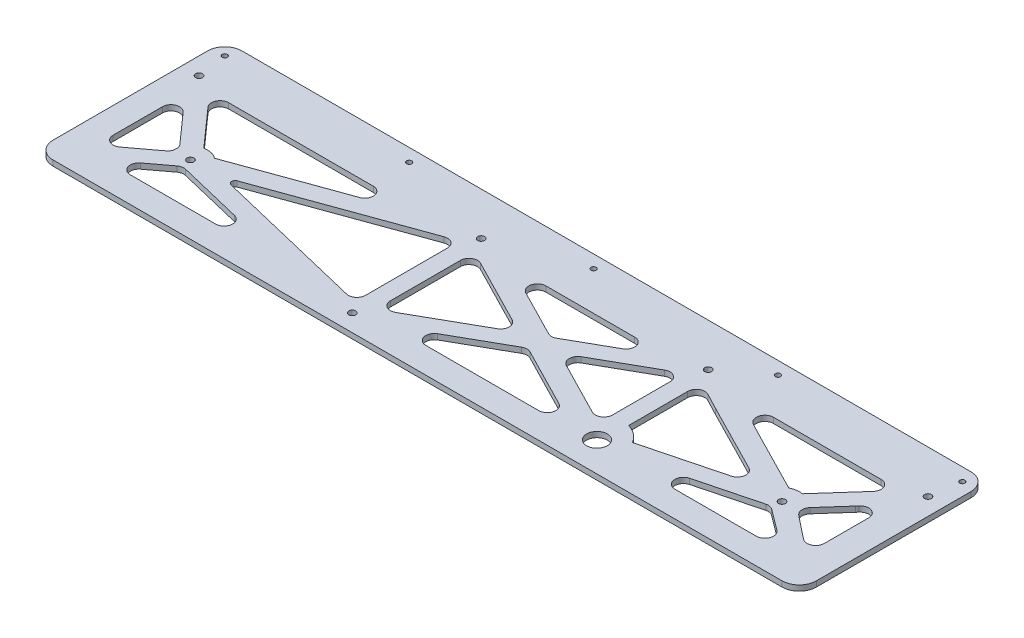
from build123d import *

# Parameters (mm, degrees)
SKETCH1_R           = 2
SKETCH1_R_2         = 6
SKETCH1_R_3         = 1.5
BOSS_EXTRUDE1_DEPTH = 3.175
FILLET1_R           = 10
CUT_EXTRUDE1_DEPTH  = 10


with BuildPart() as part:
    # Sketch1 → Boss-Extrude1 (new body)
    with BuildSketch(Plane(origin=(0, 0, 0), x_dir=(1, 0, 0), z_dir=(0, 1, 0))):
        Polygon((-26.799577535, 0), (417.700422465, 0), (417.700422465, 17.22815868), (417.700422465, 110), (-26.799577535, 110), align=None)
        with Locations((23.200422465, 40)):
            Circle(SKETCH1_R, mode=Mode.SUBTRACT)
        with Locations((367.700422465, 40)):
            Circle(SKETCH1_R, mode=Mode.SUBTRACT)
        with Locations((147.450422465, 10)):
            Circle(SKETCH1_R, mode=Mode.SUBTRACT)
        with Locations((282.700422465, 17.22815868)):
            Circle(SKETCH1_R_2, mode=Mode.SUBTRACT)
        with Locations((-16.799577535, 85)):
            Circle(SKETCH1_R, mode=Mode.SUBTRACT)
        with Locations((147.450422465, 85)):
            Circle(SKETCH1_R, mode=Mode.SUBTRACT)
        with Locations((279.700422465, 85)):
            Circle(SKETCH1_R, mode=Mode.SUBTRACT)
        with Locations((407.700422465, 85)):
            Circle(SKETCH1_R, mode=Mode.SUBTRACT)
        with Locations((-19.299577535, 102.5)):
            Circle(SKETCH1_R_3, mode=Mode.SUBTRACT)
        with Locations((88.075422465, 102.5)):
            Circle(SKETCH1_R_3, mode=Mode.SUBTRACT)
        with Locations((195.450422465, 102.5)):
            Circle(SKETCH1_R_3, mode=Mode.SUBTRACT)
        with Locations((302.825422465, 102.5)):
            Circle(SKETCH1_R_3, mode=Mode.SUBTRACT)
        with Locations((410.200422465, 102.5)):
            Circle(SKETCH1_R_3, mode=Mode.SUBTRACT)
    extrude(amount=BOSS_EXTRUDE1_DEPTH)

    # Fillet1
    fillet1_edges = [part.edges().sort_by_distance(p)[0] for p in [
        (417.700422465, 1.5875, -110),
        (417.700422465, 1.5875, 0),
        (-26.799577535, 1.5875, 0),
        (-26.799577535, 1.5875, -110),
    ]]
    fillet(fillet1_edges, radius=FILLET1_R)

    # Sketch2 → Cut-Extrude1 (cut)
    with BuildSketch(Plane(origin=(0, 3.175, 0), x_dir=(1, 0, 0), z_dir=(0, 1, 0))):
        with BuildLine():
            Line((63.988295206, 24.860334116), (26.456586442, 33.922316112))
            ThreePointArc((26.456586442, 33.922316112), (24.273585164, 33.959016834), (22.283065126, 33.061981996))
            Line((22.283065126, 33.061981996), (10.200422465, 24))
            ThreePointArc((10.200422465, 24), (8.457005975, 18.41886117), (13.200422465, 15))
            Line((13.200422465, 15), (62.81477389, 15))
            ThreePointArc((62.81477389, 15), (67.779734645, 19.409098393), (63.988295206, 24.860334116))
        make_face()
        with BuildLine():
            Line((1.731814293, 71.678180806), (21.183909441, 49.794573764))
            ThreePointArc((21.183909441, 49.794573764), (25.478109933, 49.737152551), (29.35222616, 47.883863983))
            Line((29.35222616, 47.883863983), (83.514557274, 67.5))
            Line((83.514557274, 67.5), (91.361350439, 70.2886824))
            ThreePointArc((91.361350439, 70.2886824), (94.61428981, 75.849532813), (89.686988926, 80))
            Line((89.686988926, 80), (5.468860886, 80))
            ThreePointArc((5.468860886, 80), (0.907660607, 77.048280258), (1.731814293, 71.678180806))
        make_face()
        with BuildLine():
            ThreePointArc((13.203172612, 39.765489068), (13.250707237, 41.001582191), (13.450490987, 42.222349247))
            ThreePointArc((13.450490987, 42.222349247), (13.034220935, 43.599450655), (12.243072673, 44.801021905))
            Line((12.243072673, 44.801021905), (-3.062530941, 62.019825971))
            ThreePointArc((-3.062530941, 62.019825971), (-8.576480322, 63.371615284), (-11.799577535, 58.698006777))
            Line((-11.799577535, 58.698006777), (-11.799577535, 30))
            ThreePointArc((-11.799577535, 30), (-9.035645512, 25.527864045), (-3.799577535, 26))
            Line((-3.799577535, 26), (11.506026079, 37.479202711))
            ThreePointArc((11.506026079, 37.479202711), (12.520785414, 38.498983342), (13.203172612, 39.765489068))
        make_face()
        with BuildLine():
            Line((47.554716749, 39.2633668), (136.276901149, 17.841511412))
            ThreePointArc((136.276901149, 17.841511412), (140.543349349, 18.773257577), (142.450422465, 22.701845528))
            Line((142.450422465, 22.701845528), (142.450422465, 70.404600889))
            ThreePointArc((142.450422465, 70.404600889), (140.32155553, 74.498082894), (135.747784496, 75.105773503))
            Line((135.747784496, 75.105773503), (47.343070087, 43.087969492))
            ThreePointArc((47.343070087, 43.087969492), (46.027180577, 41.096993104), (47.554716749, 39.2633668))
        make_face()
        with BuildLine():
            Line((152.450422465, 67.944146827), (152.450422465, 27.234106769))
            ThreePointArc((152.450422465, 27.234106769), (154.931598866, 22.91490225), (159.912633536, 22.882381061))
            Line((159.912633536, 22.882381061), (197.668168627, 44.244503287))
            ThreePointArc((197.668168627, 44.244503287), (200.204889799, 48.699555799), (197.486244065, 53.045981061))
            Line((197.486244065, 53.045981061), (159.730708974, 72.393898891))
            ThreePointArc((159.730708974, 72.393898891), (154.842878846, 72.210376576), (152.450422465, 67.944146827))
        make_face()
        with BuildLine():
            Line((274.700422465, 34.284011853), (274.700422465, 67.765893231))
            ThreePointArc((274.700422465, 67.765893231), (272.219246064, 72.08509775), (267.238211394, 72.117618939))
            Line((267.238211394, 72.117618939), (236.186256017, 54.548389301))
            ThreePointArc((236.186256017, 54.548389301), (233.649534845, 50.093336789), (236.368180579, 45.746911528))
            Line((236.368180579, 45.746911528), (267.420135956, 29.834259789))
            ThreePointArc((267.420135956, 29.834259789), (272.307966085, 30.017782104), (274.700422465, 34.284011853))
        make_face()
        with BuildLine():
            Line((284.700422465, 68.076898184), (284.700422465, 33.714803321))
            ThreePointArc((284.700422465, 33.714803321), (290.246819989, 30.85104203), (294.408739409, 26.198937028))
            Line((294.408739409, 26.198937028), (340.058508189, 38.011769879))
            ThreePointArc((340.058508189, 38.011769879), (343.775835313, 42.304727092), (341.082359043, 47.304045862))
            Line((341.082359043, 47.304045862), (301.204849524, 67.695954138))
            Line((301.204849524, 67.695954138), (292.020165923, 72.506208546))
            ThreePointArc((292.020165923, 72.506208546), (287.111862758, 72.354673148), (284.700422465, 68.076898184))
        make_face()
        with BuildLine():
            Line((320.393543744, 70.570564095), (326.257240647, 67.5))
            Line((326.257240647, 67.5), (362.890344157, 48.767162978))
            ThreePointArc((362.890344157, 48.767162978), (366.212170141, 49.888635144), (369.716935489, 49.794573764))
            Line((369.716935489, 49.794573764), (389.169030638, 71.678180806))
            ThreePointArc((389.169030638, 71.678180806), (389.993184323, 77.048280258), (385.431984044, 80))
            Line((385.431984044, 80), (322.713047476, 80))
            ThreePointArc((322.713047476, 80), (317.857783347, 76.194324176), (320.393543744, 70.570564095))
        make_face()
        with BuildLine():
            Line((379.559027243, 37.88827322), (390.700422465, 29))
            Line((390.700422465, 29), (393.166651981, 27.150327863))
            ThreePointArc((393.166651981, 27.150327863), (398.402719958, 26.678191908), (401.166651981, 31.150327863))
            Line((401.166651981, 31.150327863), (401.166651981, 57.012678354))
            ThreePointArc((401.166651981, 57.012678354), (397.901307442, 61.70213146), (392.370263808, 60.266512529))
            Line((392.370263808, 60.266512529), (391.437469059, 59.178180806))
            Line((391.437469059, 59.178180806), (378.940138766, 45.118684227))
            ThreePointArc((378.940138766, 45.118684227), (377.695401669, 41.370448261), (379.559027243, 37.88827322))
        make_face()
        with BuildLine():
            Line((364.296086649, 33.954363295), (329.076499674, 24.840558227))
            ThreePointArc((329.076499674, 24.840558227), (325.369116008, 19.368648725), (330.329095399, 15))
            Line((330.329095399, 15), (377.700422465, 15))
            ThreePointArc((377.700422465, 15), (382.443838955, 18.41886117), (380.700422465, 24))
            Line((380.700422465, 24), (368.548682375, 33.113805068))
            ThreePointArc((368.548682375, 33.113805068), (366.518213167, 34.018905479), (364.296086649, 33.954363295))
        make_face()
        with BuildLine():
            Line((185.278283157, 15), (251.008650991, 15))
            ThreePointArc((251.008650991, 15), (255.869142752, 18.82713179), (253.2889375, 24.449752065))
            Line((253.2889375, 24.449752065), (218.797900418, 42.124769774))
            ThreePointArc((218.797900418, 42.124769774), (216.414300992, 42.67395024), (214.055427015, 42.026757098))
            Line((214.055427015, 42.026757098), (182.816096263, 24.351739388))
            ThreePointArc((182.816096263, 24.351739388), (180.443063568, 18.726951874), (185.278283157, 15))
        make_face()
        with BuildLine():
            Line((241.872561773, 80), (190.247225864, 80))
            ThreePointArc((190.247225864, 80), (185.386734103, 76.17286821), (187.966939355, 70.550247935))
            Line((187.966939355, 70.550247935), (215.056569824, 56.668099447))
            ThreePointArc((215.056569824, 56.668099447), (217.44016925, 56.118918981), (219.799043227, 56.766112124))
            Line((219.799043227, 56.766112124), (244.334748667, 70.648260612))
            ThreePointArc((244.334748667, 70.648260612), (246.707781362, 76.273048126), (241.872561773, 80))
        make_face()
    extrude(amount=-CUT_EXTRUDE1_DEPTH, mode=Mode.SUBTRACT)


solid = part.part
